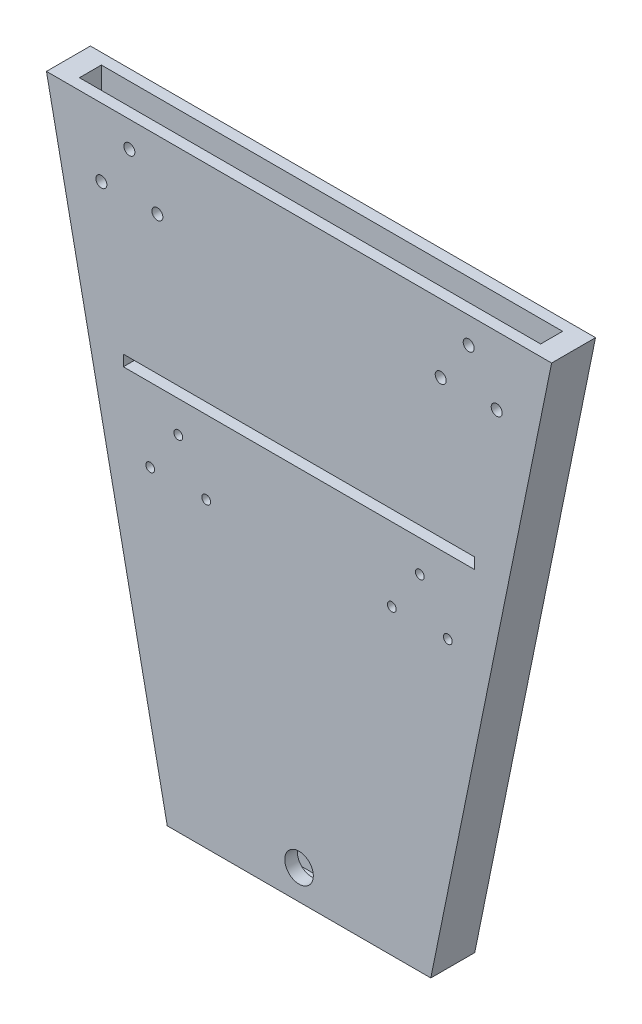
from build123d import *

# Parameters (mm, degrees)
EXTRUDE_1_DEPTH     = 20
SKETCH_3_W          = 210
SKETCH_3_H          = 10
CUT_EXTRUDE_1_DEPTH = 15
SKETCH_4_W          = 160
SKETCH_4_H          = 5
CUT_EXTRUDE_2_DEPTH = 10
SKETCH_5_R          = 2.5
SKETCH_5_R_2        = 2
CUT_EXTRUDE_3_DEPTH = 10
CUT_EXTRUDE_4_DEPTH = 4.25
SKETCH_8_R          = 6.5
CUT_EXTRUDE_6_DEPTH = 15


with BuildPart() as part:
    # 草图1 → 凸台-拉伸1 (new body)
    with BuildSketch(Plane.XY):
        Polygon((-115, 220), (115, 220), (60, -50), (-60, -50), align=None)
    extrude(amount=EXTRUDE_1_DEPTH)

    # 草图3 → 切除-拉伸1 (cut)
    with BuildSketch(Plane(origin=(0, 220, 0), x_dir=(1, 0, 0), z_dir=(0, 1, 0))):
        with Locations((0, -10)):
            Rectangle(SKETCH_3_W, SKETCH_3_H)
    extrude(amount=-CUT_EXTRUDE_1_DEPTH, mode=Mode.SUBTRACT)

    # 草图4 → 切除-拉伸2 (cut)
    with BuildSketch(Plane.XY.offset(20)):
        with Locations((0, 123.51)):
            Rectangle(SKETCH_4_W, SKETCH_4_H)
    extrude(amount=-CUT_EXTRUDE_2_DEPTH, mode=Mode.SUBTRACT)

    # 草图5 → 切除-拉伸3 (cut)
    with BuildSketch(Plane.XY.offset(20)):
        with Locations((-77.25, 208.1425573)):
            Circle(SKETCH_5_R)
        with Locations((-90, 189)):
            Circle(SKETCH_5_R)
        with Locations((-64.5, 189)):
            Circle(SKETCH_5_R)
        with Locations((-55, 106.6525573)):
            Circle(SKETCH_5_R_2)
        with Locations((-67.75, 87.51)):
            Circle(SKETCH_5_R_2)
        with Locations((-42.25, 87.51)):
            Circle(SKETCH_5_R_2)
        with Locations((42.25, 87.51)):
            Circle(SKETCH_5_R_2)
        with Locations((67.75, 87.51)):
            Circle(SKETCH_5_R_2)
        with Locations((55, 106.6525573)):
            Circle(SKETCH_5_R_2)
        with Locations((64.5, 189)):
            Circle(SKETCH_5_R)
        with Locations((90, 189)):
            Circle(SKETCH_5_R)
        with Locations((77.25, 208.1425573)):
            Circle(SKETCH_5_R)
    extrude(amount=-CUT_EXTRUDE_3_DEPTH, mode=Mode.SUBTRACT)

    # 草图6 → 切除-拉伸4 (cut, symmetric)
    with BuildSketch(Plane(origin=(0, 0, 10), x_dir=(-1, 0, 0), z_dir=(0, 0, -1))):
        with BuildLine():
            Line((0, -49.69), (18.016092171, -49.69))
            Line((18.016092171, -49.69), (11.781592332, -23.29))
            Line((11.781592332, -23.29), (0, -23.29))
            ThreePointArc((0, -23.29), (-13.2, -36.49), (0, -49.69))
        make_face()
    extrude(amount=CUT_EXTRUDE_4_DEPTH, both=True, mode=Mode.SUBTRACT)

    # 草图8 → 切除-拉伸6 (cut)
    with BuildSketch(Plane.XY.offset(20)):
        with Locations((0, -36.49)):
            Circle(SKETCH_8_R)
    extrude(amount=-CUT_EXTRUDE_6_DEPTH, mode=Mode.SUBTRACT)


solid = part.part
